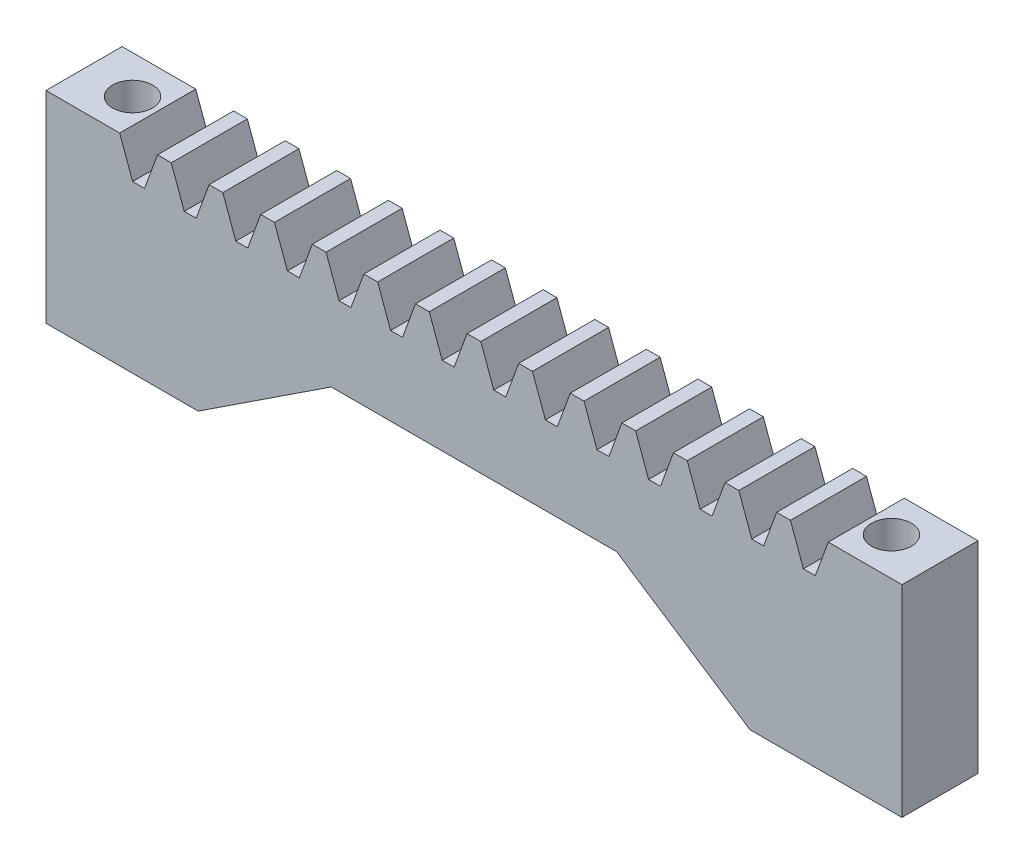
from build123d import *

# Parameters (mm, degrees)
SKETCH3_W           = 45
SKETCH3_H           = 10.6
BOSS_EXTRUDE2_DEPTH = 4
CUT_EXTRUDE4_REACH  = 44.658
SKETCH4_R           = 1.05
CUT_EXTRUDE7_REACH  = 44.513
CUT_EXTRUDE8_START  = -4
CUT_EXTRUDE8_DEPTH  = 4


# Read off the part's stored shape, not the designer's step: Cut-Extrude8
with BuildPart() as part:
    # Sketch3 → Boss-Extrude2 (new body)
    with BuildSketch(Plane.XY):
        with Locations((-18.626321401, 4.7)):
            Rectangle(SKETCH3_W, SKETCH3_H)
    extrude(amount=-BOSS_EXTRUDE2_DEPTH)

    # Sketch4 → Cut-Extrude4 (cut, up to next)
    with BuildSketch(Plane(origin=(0, 10, 0), x_dir=(1, 0, 0), z_dir=(0, 1, 0)), mode=Mode.PRIVATE) as cut_extrude4_sk1:
        with Locations(Location((-38.576321401, 2, 0), (0, 0, 180))):
            Circle(SKETCH4_R)
    cut_extrude4_tool1 = extrude(cut_extrude4_sk1.sketch, amount=-CUT_EXTRUDE4_REACH, mode=Mode.PRIVATE) & part.part
    # Sketch4 → Cut-Extrude4 (cut, up to next)
    with BuildSketch(Plane(origin=(0, 10, 0), x_dir=(1, 0, 0), z_dir=(0, 1, 0)), mode=Mode.PRIVATE) as cut_extrude4_sk2:
        with Locations(Location((1.323678599, 2, 0), (0, 0, 180))):
            Circle(SKETCH4_R)
    cut_extrude4_tool2 = extrude(cut_extrude4_sk2.sketch, amount=-CUT_EXTRUDE4_REACH, mode=Mode.PRIVATE) & part.part
    add(cut_extrude4_tool1.solids().sort_by_distance((-38.576321, 10, -2))[0], mode=Mode.SUBTRACT)
    add(cut_extrude4_tool2.solids().sort_by_distance((1.323679, 10, -2))[0], mode=Mode.SUBTRACT)

    # Sketch6 → Cut-Extrude7 (cut, up to next)
    with BuildSketch(Plane(origin=(0, 0, -4), x_dir=(-1, 0, 0), z_dir=(0, 0, -1)), mode=Mode.PRIVATE) as cut_extrude7_sk1:
        Polygon((4.126321401, -0.6), (11.126321401, 4), (26.126321401, 4), (33.126321401, -0.6), align=None)
    cut_extrude7_tool1 = extrude(cut_extrude7_sk1.sketch, amount=-CUT_EXTRUDE7_REACH, mode=Mode.PRIVATE) & part.part
    add(cut_extrude7_tool1.solids().sort_by_distance((-18.626321, 1.456061, -4))[0], mode=Mode.SUBTRACT)

    # Cut-Extrude8 outline → Cut-Extrude8 (cut)
    with BuildSketch(Plane.XY.offset(CUT_EXTRUDE8_START)):
        Polygon((-35.264703894, 10), (-37.252642802, 10), (-36.571857508, 8.129557778), (-35.945489188, 8.129557778), align=None)
        Polygon((0, 10), (-1.987938907, 10), (-1.307153614, 8.129557778), (-0.680785294, 8.129557778), align=None)
        Polygon((-2.71266953, 10), (-4.700608438, 10), (-4.019823144, 8.129557778), (-3.393454824, 8.129557778), align=None)
        Polygon((-5.425339061, 10), (-7.413277968, 10), (-6.732492674, 8.129557778), (-6.106124354, 8.129557778), align=None)
        Polygon((-8.138008591, 10), (-10.125947498, 10), (-9.445162205, 8.129557778), (-8.818793885, 8.129557778), align=None)
        Polygon((-10.850678121, 10), (-12.838617029, 10), (-12.157831735, 8.129557778), (-11.531463415, 8.129557778), align=None)
        Polygon((-13.563347652, 10), (-15.551286559, 10), (-14.870501265, 8.129557778), (-14.244132945, 8.129557778), align=None)
        Polygon((-16.276017182, 10), (-18.263956089, 10), (-17.583170796, 8.129557778), (-16.956802476, 8.129557778), align=None)
        Polygon((-18.988686712, 10), (-20.97662562, 10), (-20.295840326, 8.129557778), (-19.669472006, 8.129557778), align=None)
        Polygon((-21.701356243, 10), (-23.68929515, 10), (-23.008509856, 8.129557778), (-22.382141536, 8.129557778), align=None)
        Polygon((-24.414025773, 10), (-26.40196468, 10), (-25.721179387, 8.129557778), (-25.094811067, 8.129557778), align=None)
        Polygon((-27.126695303, 10), (-29.114634211, 10), (-28.433848917, 8.129557778), (-27.807480597, 8.129557778), align=None)
        Polygon((-29.839364834, 10), (-31.827303741, 10), (-31.146518447, 8.129557778), (-30.520150127, 8.129557778), align=None)
        Polygon((-32.552034364, 10), (-34.539973271, 10), (-33.859187978, 8.129557778), (-33.232819658, 8.129557778), align=None)
    extrude(amount=CUT_EXTRUDE8_DEPTH, mode=Mode.SUBTRACT)


solid = part.part
